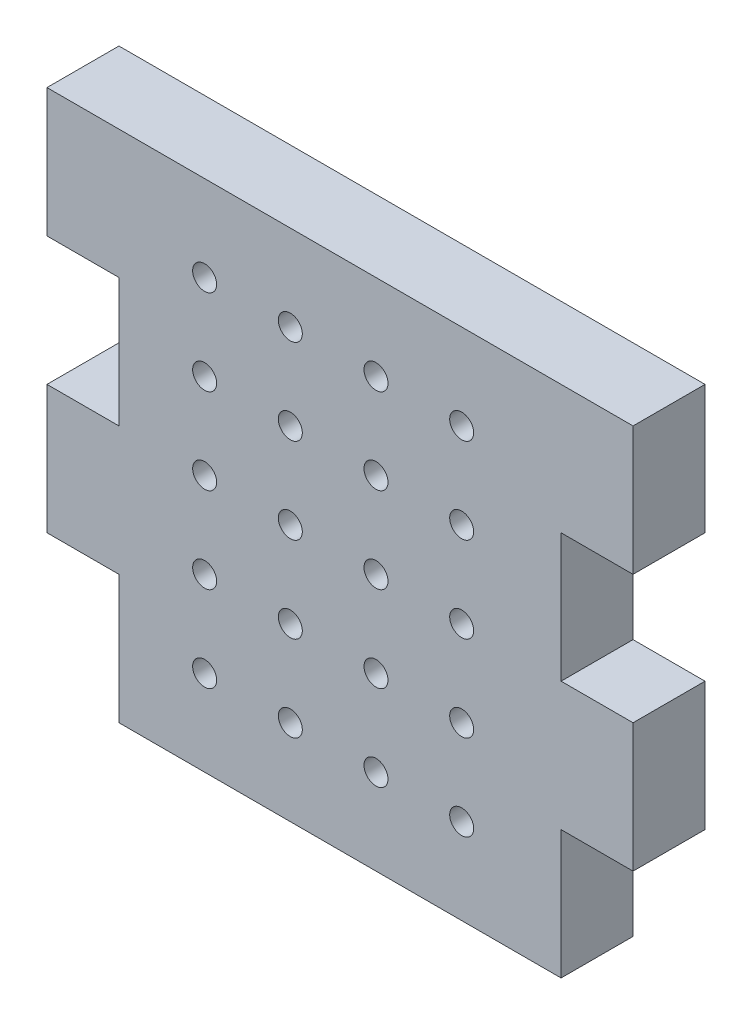
from build123d import *

# Parameters (mm, degrees)
SKETCH1_W           = 43.434
SKETCH1_H           = 38.1
BOSS_EXTRUDE1_DEPTH = 5.334
SKETCH2_W           = 5.334
SKETCH2_H           = 9.525
CUT_EXTRUDE1_DEPTH  = 92.449120695
SKETCH3_R           = 0.889
CUT_EXTRUDE2_DEPTH  = 92.449120695


with BuildPart() as part:
    # Sketch1 → Boss-Extrude1 (new body)
    with BuildSketch(Plane.XY):
        with Locations((-66.368249325, -4.939142782)):
            Rectangle(SKETCH1_W, SKETCH1_H)
    extrude(amount=BOSS_EXTRUDE1_DEPTH)

    # Sketch2 → Cut-Extrude1 (cut, through all)
    with BuildSketch(Plane.XY.offset(5.334)):
        with Locations((-85.418249325, -19.226642782)):
            Rectangle(SKETCH2_W, SKETCH2_H)
        with Locations((-85.418249325, -0.176642782)):
            Rectangle(SKETCH2_W, SKETCH2_H)
        with Locations((-47.318249325, -0.176642782)):
            Rectangle(SKETCH2_W, SKETCH2_H)
        with Locations((-47.318249325, -19.226642782)):
            Rectangle(SKETCH2_W, SKETCH2_H)
    extrude(amount=-CUT_EXTRUDE1_DEPTH, mode=Mode.SUBTRACT)

    # Sketch3 → Cut-Extrude2 (cut, through all)
    with BuildSketch(Plane.XY.offset(5.334)):
        with Locations((-76.401249325, 7.760857218)):
            Circle(SKETCH3_R)
        with Locations((-70.051249325, 7.760857218)):
            Circle(SKETCH3_R)
        with Locations((-63.701249325, 7.760857218)):
            Circle(SKETCH3_R)
        with Locations((-57.351249325, 7.760857218)):
            Circle(SKETCH3_R)
        with Locations((-76.401249325, 1.410857218)):
            Circle(SKETCH3_R)
        with Locations((-70.051249325, 1.410857218)):
            Circle(SKETCH3_R)
        with Locations((-63.701249325, 1.410857218)):
            Circle(SKETCH3_R)
        with Locations((-57.351249325, 1.410857218)):
            Circle(SKETCH3_R)
        with Locations((-76.401249325, -4.939142782)):
            Circle(SKETCH3_R)
        with Locations((-70.051249325, -4.939142782)):
            Circle(SKETCH3_R)
        with Locations((-63.701249325, -4.939142782)):
            Circle(SKETCH3_R)
        with Locations((-57.351249325, -4.939142782)):
            Circle(SKETCH3_R)
        with Locations((-76.401249325, -11.289142782)):
            Circle(SKETCH3_R)
        with Locations((-70.051249325, -11.289142782)):
            Circle(SKETCH3_R)
        with Locations((-63.701249325, -11.289142782)):
            Circle(SKETCH3_R)
        with Locations((-57.351249325, -11.289142782)):
            Circle(SKETCH3_R)
        with Locations((-76.401249325, -17.639142782)):
            Circle(SKETCH3_R)
        with Locations((-70.051249325, -17.639142782)):
            Circle(SKETCH3_R)
        with Locations((-63.701249325, -17.639142782)):
            Circle(SKETCH3_R)
        with Locations((-57.351249325, -17.639142782)):
            Circle(SKETCH3_R)
    extrude(amount=-CUT_EXTRUDE2_DEPTH, mode=Mode.SUBTRACT)


solid = part.part
